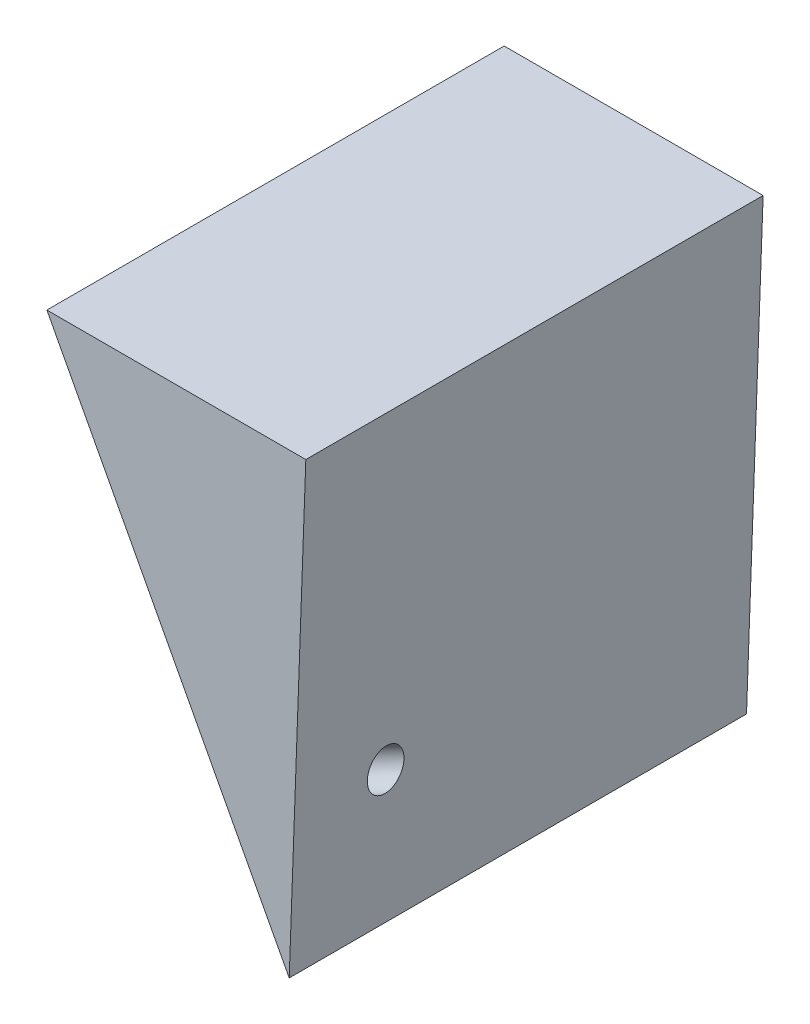
from build123d import *

# Parameters (mm, degrees)
BOSS_EXTRUDE1_DEPTH = 50
SKETCH2_R           = 2
CUT_EXTRUDE1_DEPTH  = 50


with BuildPart() as part:
    # Sketch1 → Boss-Extrude1 (new body)
    with BuildSketch(Plane.XY):
        Polygon((-36.238637744, 19.241346543), (-9.742760301, -30.758653457), (-7.926733978, 19.241346543), align=None)
    extrude(amount=BOSS_EXTRUDE1_DEPTH)

    # Sketch2 → Cut-Extrude1 (cut)
    with BuildSketch(Plane(origin=(-20.332646925, -10.77462642, 0), x_dir=(0, 0, 1), z_dir=(-0.8836030430860087, -0.46823675875474063, 0))):
        with Locations((40, -9.616521291)):
            Circle(SKETCH2_R)
    extrude(amount=-CUT_EXTRUDE1_DEPTH, mode=Mode.SUBTRACT)


solid = part.part
